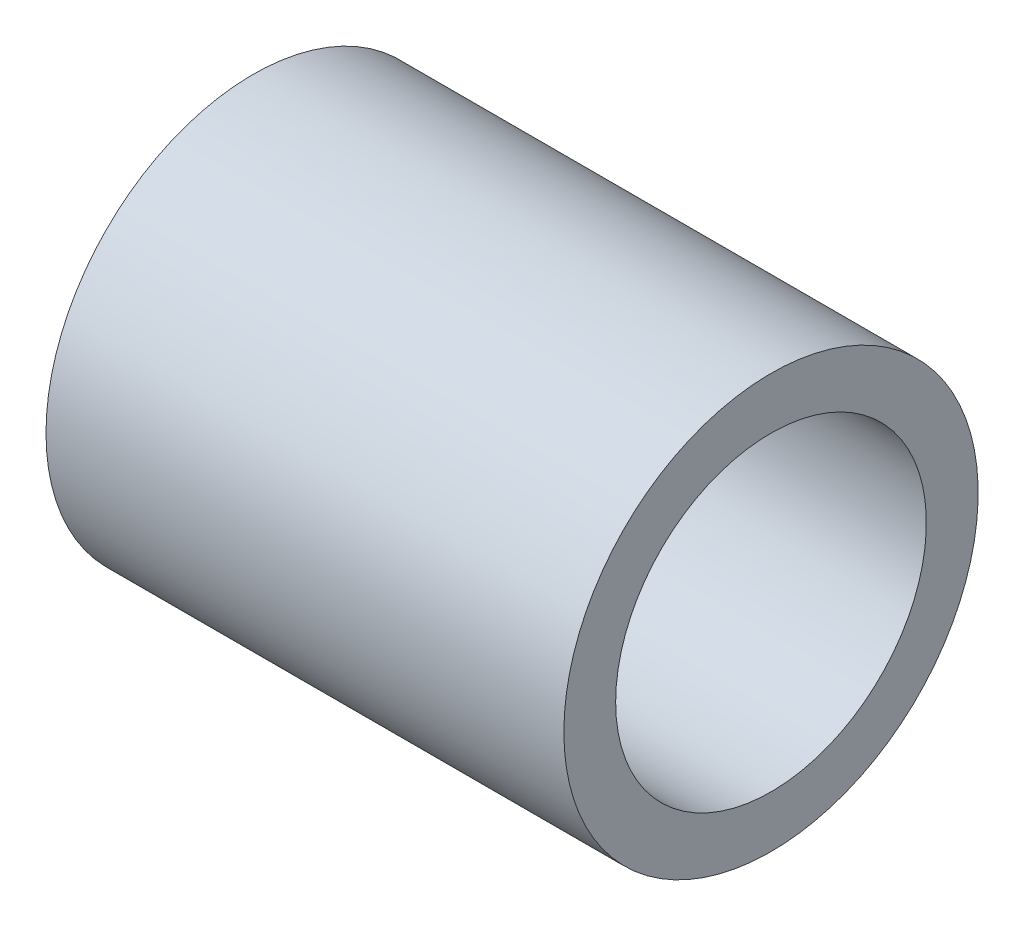
from build123d import *

# Parameters (mm, degrees)
BUSHING_SKETCH_W = 10
BUSHING_SKETCH_H = 1


with BuildPart() as part:
    # Bushing Sketch → Bushing (revolve)
    with BuildSketch(Plane.XY):
        with Locations((85, 3.5)):
            Rectangle(BUSHING_SKETCH_W, BUSHING_SKETCH_H)
    revolve(axis=Axis((-1000, 0, 0), (1, 0, 0)))


solid = part.part
